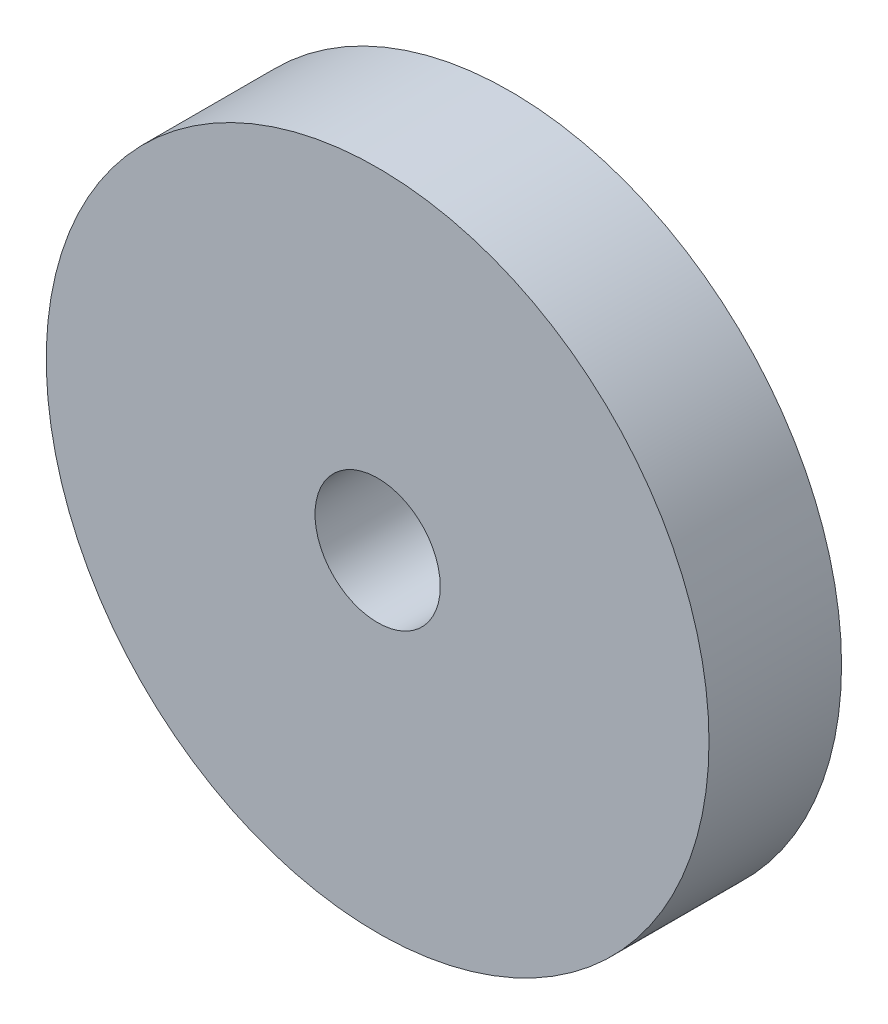
from build123d import *

# Parameters (mm, degrees)
SKETCH1_R           = 7.9375
SKETCH1_R_2         = 1.5
BOSS_EXTRUDE1_DEPTH = 3.175


with BuildPart() as part:
    # Sketch1 → Boss-Extrude1 (new body)
    with BuildSketch(Plane.XY):
        Circle(SKETCH1_R)
        Circle(SKETCH1_R_2, mode=Mode.SUBTRACT)
    extrude(amount=BOSS_EXTRUDE1_DEPTH)


solid = part.part
